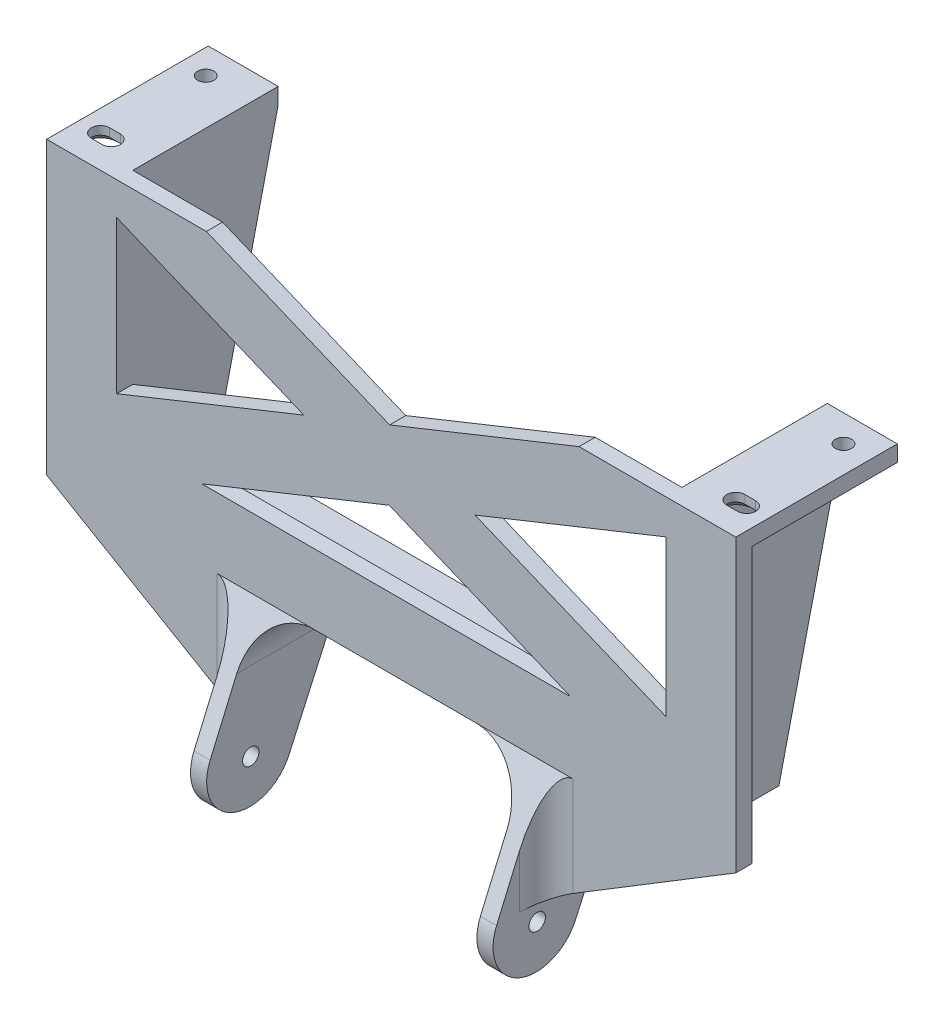
from build123d import *

# Parameters (mm, degrees)
BOSS_EXTRUDE1_DEPTH                            = 3
BOSS_EXTRUDE2_DEPTH                            = 15
SKETCH4_W                                      = 13
SKETCH4_H                                      = 3
BOSS_EXTRUDE3_DEPTH                            = 12
BOSS_EXTRUDE4_DEPTH                            = 3
BOSS_EXTRUDE5_DEPTH                            = 3
SKETCH7_R                                      = 1.525
BOSS_EXTRUDE6_DEPTH                            = 3
BOSS_EXTRUDE7_START                            = 3
SKETCH8_R                                      = 1.525
BOSS_EXTRUDE7_DEPTH                            = 3
BOSS_EXTRUDE8_DEPTH                            = 3
FILLET2_R                                      = 10
FILLET3_R                                      = 5
CSK_START                                      = -8
CSK_SLOT_FOR_M3_FLAT_HEAD_MACHINE_SCREW1_DEPTH = 3
F_3_0MM_DOWEL_HOLE2_D                          = 3
F_3_0MM_DOWEL_HOLE2_DEPTH                      = 7.5
F_3_0MM_DOWEL_HOLE2_CSINK_D                    = 3.05
F_3_0MM_DOWEL_HOLE2_CSINK_ANGLE                = 90
F_3_0MM_DOWEL_HOLE2_TIP                        = 0.901290929


with BuildPart() as part:
    # Sketch1 → Boss-Extrude1 (new body)
    with BuildSketch(Plane.XY):
        Polygon((139, -5), (109.876604516, -5), (74.70251528, -19.102143128), (40.663008058, -5), (11, -5), (11, -59.019998994), (139, -59.019998994), align=None)
        Polygon((126, -11.464259225), (90.561608439, -25.672367549), (126, -40.354051004), align=None, mode=Mode.SUBTRACT)
        Polygon((24, -11.085769738), (24, -39.430007843), (58.769174389, -25.49020487), align=None, mode=Mode.SUBTRACT)
        Polygon((39.809790244, -46.019998994), (108.323633524, -46.019998994), (74.628267548, -32.06042929), align=None, mode=Mode.SUBTRACT)
    extrude(amount=-BOSS_EXTRUDE1_DEPTH)

    # Sketch3 → Boss-Extrude2 (add)
    with BuildSketch(Plane(origin=(0, 0, -3), x_dir=(-1, 0, 0), z_dir=(0, 0, -1))):
        Polygon((-139, -8), (-139, -5), (-126, -5), (-126, -56.019998994), (-24, -56.019998994), (-24, -5), (-11, -5), (-11, -8), (-21, -8), (-21, -59.019998994), (-129, -59.019998994), (-129, -8), align=None)
    extrude(amount=BOSS_EXTRUDE2_DEPTH)

    # Sketch4 → Boss-Extrude3 (add)
    with BuildSketch(Plane(origin=(0, 0, -18), x_dir=(-1, 0, 0), z_dir=(0, 0, -1))):
        with Locations((-132.5, -6.5)):
            Rectangle(SKETCH4_W, SKETCH4_H)
        with Locations((-17.5, -6.5)):
            Rectangle(SKETCH4_W, SKETCH4_H)
    extrude(amount=BOSS_EXTRUDE3_DEPTH)

    # Sketch5 → Boss-Extrude4 (add)
    with BuildSketch(Plane.ZY.offset(-21)):
        Polygon((-30, -8), (-18, -8), (-18, -59.019998994), align=None)
    extrude(amount=-BOSS_EXTRUDE4_DEPTH)

    # Sketch6 → Boss-Extrude5 (add)
    with BuildSketch(Plane(origin=(129, 0, 0), x_dir=(0, 0, -1), z_dir=(1, 0, 0))):
        Polygon((18, -8), (18, -59.019998994), (30, -8), align=None)
    extrude(amount=-BOSS_EXTRUDE5_DEPTH)

    # Sketch7 → Boss-Extrude6 (add)
    with BuildSketch(Plane(origin=(50.603026188, 28.677278628, 20.937913876), x_dir=(0, 0.9992078437352027, -0.039795540177848664), z_dir=(-1, 0, 0))):
        with BuildLine():
            Line((-86.078252358, 42.397029499), (-86.675185461, 27.408911843))
            Line((-86.675185461, 27.408911843), (-86.794572081, 24.411288312))
            Line((-86.794572081, 24.411288312), (-108.590752447, 16.032710832))
            ThreePointArc((-108.590752447, 16.032710832), (-118.903275809, 20.564727028), (-114.461076578, 30.916257103))
            Line((-114.461076578, 30.916257103), (-86.078252358, 42.397029499))
        make_face()
        with Locations(Location((-111.454014111, 23.696060126, 0), (0, 0, 267.719281244))):
            Circle(SKETCH7_R, mode=Mode.SUBTRACT)
    extrude(amount=BOSS_EXTRUDE6_DEPTH)

    # Sketch8 → Boss-Extrude7 (add)
    with BuildSketch(Plane(origin=(100.803026188, 28.677278628, 20.937913876), x_dir=(0, -0.9992078437352027, 0.039795540177848664), z_dir=(1, 0, 0)).offset(BOSS_EXTRUDE7_START)):
        with BuildLine():
            Line((86.078252358, 42.397029499), (86.675185461, 27.408911843))
            Line((86.675185461, 27.408911843), (86.794572081, 24.411288312))
            Line((86.794572081, 24.411288312), (108.590752447, 16.032710832))
            ThreePointArc((108.590752447, 16.032710832), (118.903275809, 20.564727028), (114.461076578, 30.916257103))
            Line((114.461076578, 30.916257103), (86.078252358, 42.397029499))
        make_face()
        with Locations(Location((111.454014111, 23.696060126, 0), (0, 0, 272.280718756))):
            Circle(SKETCH8_R, mode=Mode.SUBTRACT)
    extrude(amount=-BOSS_EXTRUDE7_DEPTH)

    # Sketch9 → Boss-Extrude8 (add)
    with BuildSketch(Plane.XY):
        Polygon((11, -59.019998994), (47.603026188, -59.019998994), (47.603026188, -80.465483362), align=None)
        Polygon((103.803026188, -59.019998994), (139, -59.019998994), (103.803026188, -80.465483362), align=None)
    extrude(amount=-BOSS_EXTRUDE8_DEPTH)

    # Fillet2
    fillet2_edges = [part.edges().sort_by_distance(p)[0] for p in [
        (50.603026188, -59.019998994, -9),
        (103.803026188, -59.019998994, -10.5),
        (100.803026188, -59.019998994, -9),
        (47.603026188, -59.019998994, -10.5),
    ]]
    fillet(fillet2_edges, radius=FILLET2_R)

    # Fillet3
    fillet3_edges = [part.edges().sort_by_distance(p)[0] for p in [
        (47.603026188, -69.742741178, 0),
        (29.301513094, -59.019998994, -3),
        (103.803026188, -69.742741178, 0),
        (103.803026188, -74.742741178, -3),
        (121.401513094, -59.019998994, -3),
        (106.731958376, -61.948931182, -3),
        (47.603026188, -74.742741178, -3),
        (44.674094, -61.948931182, -3),
    ]]
    fillet(fillet3_edges, radius=FILLET3_R)

    # CSK SLOT for M3 Flat Head Machine Screw1: read off the stored shape, not the designer's step
    # CSK SLOT for M3 Flat Head Machine Sc 2 → CSK SLOT for M3 Flat Head Machine Screw1 (cut)
    with BuildSketch(Plane(origin=(0, 0, 0), x_dir=(1, 0, 0), z_dir=(0, 1, 0)).offset(CSK_START)):
        with BuildLine():
            ThreePointArc((17, 4.3), (18.7, 6), (17, 7.7))
            Line((17, 7.7), (15, 7.7))
            ThreePointArc((15, 7.7), (13.3, 6), (15, 4.3))
            Line((15, 4.3), (17, 4.3))
        make_face()
        with BuildLine():
            ThreePointArc((133, 7.7), (131.3, 6), (133, 4.3))
            Line((133, 4.3), (135, 4.3))
            ThreePointArc((135, 4.3), (136.7, 6), (135, 7.7))
            Line((135, 7.7), (133, 7.7))
        make_face()
    extrude(amount=CSK_SLOT_FOR_M3_FLAT_HEAD_MACHINE_SCREW1_DEPTH, mode=Mode.SUBTRACT)

    # CSK SLOT for M3 Flat Head Machine Sc 3: loft between two sections, ruled curve by curve
    csk_slot_for_m3_flat_head_machine_sc_3_from = [
        Edge.make_three_point_arc((17, -6.55, -7.7), (18.202081528, -6.55, -7.202081528), (18.7, -6.55, -6)),
        Edge.make_three_point_arc((18.7, -6.55, -6), (18.202081528, -6.55, -4.797918472), (17, -6.55, -4.3)),
        Edge.make_three_point_arc((15, -6.55, -4.3), (13.797918472, -6.55, -4.797918472), (13.3, -6.55, -6)),
        Edge.make_three_point_arc((13.3, -6.55, -6), (13.797918472, -6.55, -7.202081528), (15, -6.55, -7.7)),
        Edge.make_line((17, -6.55, -4.3), (15, -6.55, -4.3)),
        Edge.make_line((17, -6.55, -7.7), (15, -6.55, -7.7)),
    ]
    csk_slot_for_m3_flat_head_machine_sc_3_to = [
        Edge.make_three_point_arc((17, -8, -9.15), (19.227386361, -8, -8.227386361), (20.15, -8, -6)),
        Edge.make_three_point_arc((20.15, -8, -6), (19.227386361, -8, -3.772613639), (17, -8, -2.85)),
        Edge.make_three_point_arc((15, -8, -2.85), (12.772613639, -8, -3.772613639), (11.85, -8, -6)),
        Edge.make_three_point_arc((11.85, -8, -6), (12.772613639, -8, -8.227386361), (15, -8, -9.15)),
        Edge.make_line((17, -8, -2.85), (15, -8, -2.85)),
        Edge.make_line((17, -8, -9.15), (15, -8, -9.15)),
    ]
    csk_slot_for_m3_flat_head_machine_sc_3 = Solid(Shell([*[Face.make_surface_from_curves(csk_slot_for_m3_flat_head_machine_sc_3_from[k], csk_slot_for_m3_flat_head_machine_sc_3_to[k]) for k in range(6)], Face(Wire(csk_slot_for_m3_flat_head_machine_sc_3_from)), Face(Wire(csk_slot_for_m3_flat_head_machine_sc_3_to))]))
    add(csk_slot_for_m3_flat_head_machine_sc_3, mode=Mode.SUBTRACT)

    # CSK SLOT for M3 Flat Head Machine Sc 4: loft between two sections, ruled curve by curve
    csk_slot_for_m3_flat_head_machine_sc_4_from = [
        Edge.make_three_point_arc((135, -6.55, -7.7), (136.202081528, -6.55, -7.202081528), (136.7, -6.55, -6)),
        Edge.make_three_point_arc((136.7, -6.55, -6), (136.202081528, -6.55, -4.797918472), (135, -6.55, -4.3)),
        Edge.make_three_point_arc((133, -6.55, -4.3), (131.797918472, -6.55, -4.797918472), (131.3, -6.55, -6)),
        Edge.make_three_point_arc((131.3, -6.55, -6), (131.797918472, -6.55, -7.202081528), (133, -6.55, -7.7)),
        Edge.make_line((135, -6.55, -4.3), (133, -6.55, -4.3)),
        Edge.make_line((135, -6.55, -7.7), (133, -6.55, -7.7)),
    ]
    csk_slot_for_m3_flat_head_machine_sc_4_to = [
        Edge.make_three_point_arc((135, -8, -9.15), (137.227386361, -8, -8.227386361), (138.15, -8, -6)),
        Edge.make_three_point_arc((138.15, -8, -6), (137.227386361, -8, -3.772613639), (135, -8, -2.85)),
        Edge.make_three_point_arc((133, -8, -2.85), (130.772613639, -8, -3.772613639), (129.85, -8, -6)),
        Edge.make_three_point_arc((129.85, -8, -6), (130.772613639, -8, -8.227386361), (133, -8, -9.15)),
        Edge.make_line((135, -8, -2.85), (133, -8, -2.85)),
        Edge.make_line((135, -8, -9.15), (133, -8, -9.15)),
    ]
    csk_slot_for_m3_flat_head_machine_sc_4 = Solid(Shell([*[Face.make_surface_from_curves(csk_slot_for_m3_flat_head_machine_sc_4_from[k], csk_slot_for_m3_flat_head_machine_sc_4_to[k]) for k in range(6)], Face(Wire(csk_slot_for_m3_flat_head_machine_sc_4_from)), Face(Wire(csk_slot_for_m3_flat_head_machine_sc_4_to))]))
    add(csk_slot_for_m3_flat_head_machine_sc_4, mode=Mode.SUBTRACT)

    # Ø3.0mm Dowel Hole2
    with Locations(Plane(origin=(134, -8, -25), x_dir=(0, 0, -1), z_dir=(0, -1, 0))):
        with Locations((0, 0), (0, -118.445937781)):
            CounterSinkHole(F_3_0MM_DOWEL_HOLE2_D / 2, F_3_0MM_DOWEL_HOLE2_CSINK_D / 2, depth=F_3_0MM_DOWEL_HOLE2_DEPTH, counter_sink_angle=F_3_0MM_DOWEL_HOLE2_CSINK_ANGLE)
            with Locations((0, 0, -(F_3_0MM_DOWEL_HOLE2_DEPTH + F_3_0MM_DOWEL_HOLE2_TIP / 2))):  # 118° drill point
                Cone(0, F_3_0MM_DOWEL_HOLE2_D / 2, F_3_0MM_DOWEL_HOLE2_TIP, mode=Mode.SUBTRACT)


solid = part.part
